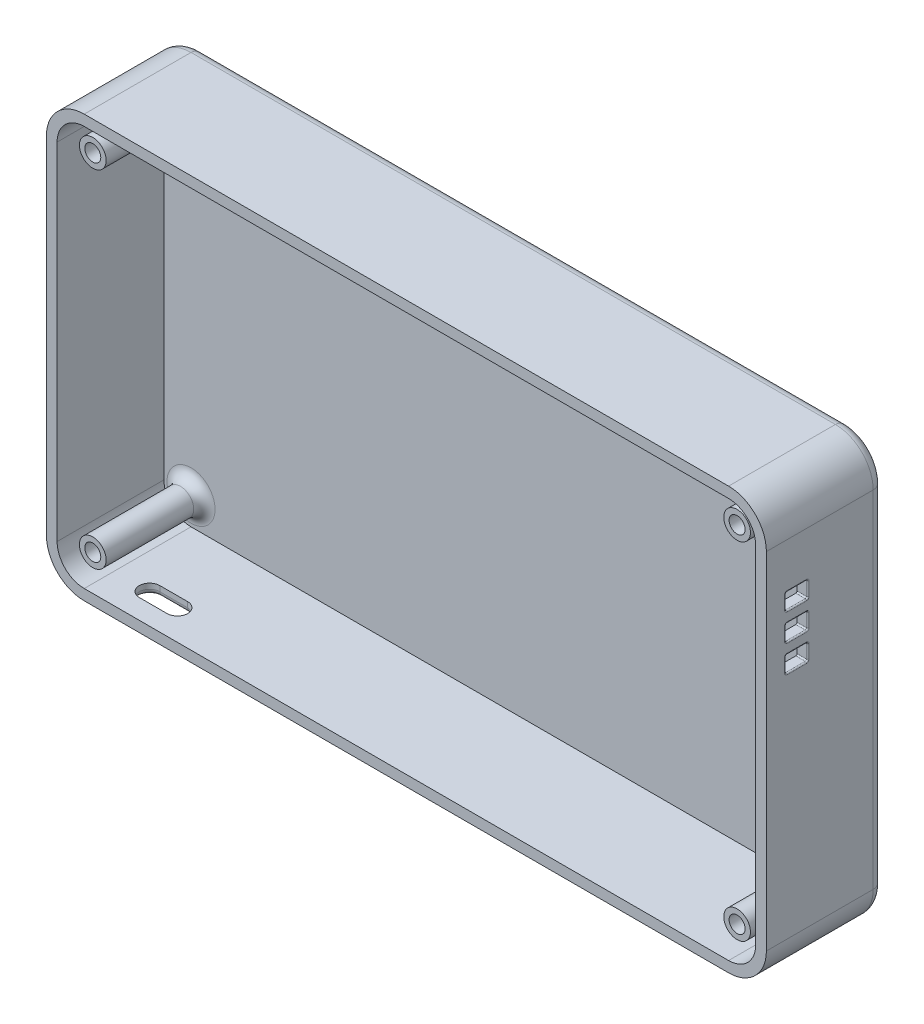
from build123d import *

# Parameters (mm, degrees)
ESQUISSE1_R             = 2.498391832
ESQUISSE1_R_2           = 2.5
BOSS_EXTRU_1_DEPTH      = 20
COQUE1_T                = 2
CONG_1_R                = 2
ESQUISSE2_R             = 1.5
ENL_V_MAT_EXTRU_1_DEPTH = 15
CONG_2_R                = 2
ESQUISSE6_R             = 2.498391832
ESQUISSE6_R_2           = 2.5
ENL_V_MAT_EXTRU_2_DEPTH = 15
ENL_V_MAT_EXTRU_3_DEPTH = 10
CONG_3_R                = 1
ESQUISSE9_W             = 4.1
ESQUISSE9_H             = 3
ENL_V_MAT_EXTRU_4_DEPTH = 10
CONG_4_R                = 0.25
ESQUISSE10_R            = 2.4
ENL_V_MAT_EXTRU_5_DEPTH = 10
CONG_5_R                = 0.25


with BuildPart() as part:
    # Esquisse1 → Boss.-Extru.1 (new body)
    with BuildSketch(Plane.XY):
        with BuildLine():
            Line((33.02, -40.64), (153.67, -40.64))
            ThreePointArc((153.67, -40.64), (157.262102448, -42.127897552), (158.75, -45.72))
            Line((158.75, -45.72), (158.75, -110.49))
            ThreePointArc((158.75, -110.49), (157.262102448, -114.082102448), (153.67, -115.57))
            Line((153.67, -115.57), (33.02, -115.57))
            ThreePointArc((33.02, -115.57), (29.427897552, -114.082102448), (27.94, -110.49))
            Line((27.94, -110.49), (27.94, -45.72))
            ThreePointArc((27.94, -45.72), (29.427897552, -42.127897552), (33.02, -40.64))
        make_face()
        with Locations((153.67, -110.49)):
            Circle(ESQUISSE1_R, mode=Mode.SUBTRACT)
        with Locations((33.02, -110.49)):
            Circle(ESQUISSE1_R_2, mode=Mode.SUBTRACT)
        with Locations((153.67, -45.72)):
            Circle(ESQUISSE1_R_2, mode=Mode.SUBTRACT)
        with Locations((33.02, -45.72)):
            Circle(ESQUISSE1_R_2, mode=Mode.SUBTRACT)
    extrude(amount=BOSS_EXTRU_1_DEPTH)

    # Coque1
    coque1_openings = [part.faces().sort_by_distance(p)[0] for p in [
        (93.345157035, -78.105084303, 20),
    ]]
    offset(amount=COQUE1_T, openings=coque1_openings, kind=Kind.INTERSECTION)

    # Congé1
    # the kernel refuses this fillet: 2 mm, written as the material it takes off along each edge
    with BuildSketch(Plane(origin=(33.02, -117.57, -2), x_dir=(0, 0, 1), z_dir=(1, 0, 0)), Plane(origin=(153.67, -38.64, -2), x_dir=(0, 0, 1), z_dir=(-1, 0, 0))) as cong_1_piece_1:
        with BuildLine():
            CenterArc((CONG_1_R, -CONG_1_R), CONG_1_R, 90, 90)
            Line((0, -CONG_1_R), (0, 0))
            Line((0, 0), (CONG_1_R, 0))
        make_face()
    extrude(amount=120.65, mode=Mode.SUBTRACT)
    with BuildSketch(Plane(origin=(33.02, -110.49, -2), x_dir=(0, -1, 0), z_dir=(1, 0, 0))) as cong_1_piece_2:
        with BuildLine():
            CenterArc((7.08 - CONG_1_R, -CONG_1_R), CONG_1_R, 0, 90)
            Line((7.08 - CONG_1_R, 0), (7.08, 0))
            Line((7.08, 0), (7.08, -CONG_1_R))
        make_face()
    revolve(axis=Axis((33.02, -110.49, -2), (0, 0, -1)), revolution_arc=90, mode=Mode.SUBTRACT)
    with BuildSketch(Plane(origin=(25.94, -45.72, -2), x_dir=(0, 0, 1), z_dir=(0, -1, 0)), Plane(origin=(160.75, -110.49, -2), x_dir=(0, 0, 1), z_dir=(0, 1, 0))) as cong_1_piece_3:
        with BuildLine():
            CenterArc((CONG_1_R, -CONG_1_R), CONG_1_R, 90, 90)
            Line((0, -CONG_1_R), (0, 0))
            Line((0, 0), (CONG_1_R, 0))
        make_face()
    extrude(amount=64.77, mode=Mode.SUBTRACT)
    with BuildSketch(Plane(origin=(33.02, -45.72, -2), x_dir=(-1, 0, 0), z_dir=(0, -1, 0))) as cong_1_piece_4:
        with BuildLine():
            CenterArc((7.08 - CONG_1_R, -CONG_1_R), CONG_1_R, 0, 90)
            Line((7.08 - CONG_1_R, 0), (7.08, 0))
            Line((7.08, 0), (7.08, -CONG_1_R))
        make_face()
    revolve(axis=Axis((33.02, -45.72, -2), (0, 0, -1)), revolution_arc=90, mode=Mode.SUBTRACT)
    with BuildSketch(Plane(origin=(153.67, -45.72, -2), x_dir=(0, 1, 0), z_dir=(-1, 0, 0))) as cong_1_piece_5:
        with BuildLine():
            CenterArc((7.08 - CONG_1_R, -CONG_1_R), CONG_1_R, 0, 90)
            Line((7.08 - CONG_1_R, 0), (7.08, 0))
            Line((7.08, 0), (7.08, -CONG_1_R))
        make_face()
    revolve(axis=Axis((153.67, -45.72, -2), (0, 0, -1)), revolution_arc=90, mode=Mode.SUBTRACT)
    with BuildSketch(Plane(origin=(153.67, -110.49, -2), x_dir=(1, 0, 0), z_dir=(0, 1, 0))) as cong_1_piece_6:
        with BuildLine():
            CenterArc((7.08 - CONG_1_R, -CONG_1_R), CONG_1_R, 0, 90)
            Line((7.08 - CONG_1_R, 0), (7.08, 0))
            Line((7.08, 0), (7.08, -CONG_1_R))
        make_face()
    revolve(axis=Axis((153.67, -110.49, -2), (0, 0, -1)), revolution_arc=90, mode=Mode.SUBTRACT)

    # Esquisse2 → Enlèv. mat.-Extru.1 (cut)
    with BuildSketch(Plane.XY.offset(20)):
        with Locations((153.67, -110.49)):
            Circle(ESQUISSE2_R)
        with Locations((33.02, -110.49)):
            Circle(ESQUISSE2_R)
        with Locations((33.02, -45.72)):
            Circle(ESQUISSE2_R)
        with Locations((153.67, -45.72)):
            Circle(ESQUISSE2_R)
    extrude(amount=-ENL_V_MAT_EXTRU_1_DEPTH, mode=Mode.SUBTRACT)

    # Congé2
    cong_2_edges = [part.edges().sort_by_distance(p)[0] for p in [
        (151.17, -45.72, 0),
        (151.171608168, -110.49, 0),
        (30.52, -110.49, 0),
        (30.52, -45.72, 0),
    ]]
    fillet(cong_2_edges, radius=CONG_2_R)

    # Esquisse6 → Enlèv. mat.-Extru.2 (cut)
    with BuildSketch(Plane.XY.offset(18.4)):
        with Locations(Location((153.67, -110.49, 0), (0, 0, 180))):
            Circle(ESQUISSE6_R)
        with Locations(Location((33.02, -110.49, 0), (0, 0, 180))):
            Circle(ESQUISSE6_R_2)
        with Locations(Location((33.02, -45.72, 0), (0, 0, 180))):
            Circle(ESQUISSE6_R_2)
        with Locations(Location((153.67, -45.72, 0), (0, 0, 180))):
            Circle(ESQUISSE6_R_2)
    extrude(amount=ENL_V_MAT_EXTRU_2_DEPTH, mode=Mode.SUBTRACT)

    # Esquisse7 → Enlèv. mat.-Extru.3 (cut)
    with BuildSketch(Plane.XZ.offset(117.57)):
        with BuildLine():
            Line((39.627249329, 16.302213906), (44.832750671, 16.302213906))
            ThreePointArc((44.832750671, 16.302213906), (46.763115827, 14.371848749), (44.832750671, 12.441483593))
            Line((44.832750671, 12.441483593), (39.627249329, 12.441483593))
            ThreePointArc((39.627249329, 12.441483593), (37.696884173, 14.371848749), (39.627249329, 16.302213906))
        make_face()
    extrude(amount=-ENL_V_MAT_EXTRU_3_DEPTH, mode=Mode.SUBTRACT)

    # Congé3
    cong_3_edges = [part.edges().sort_by_distance(p)[0] for p in [
        (37.696884173, -117.57, 14.371848749),
        (42.23, -117.57, 12.441483593),
        (46.763115827, -117.57, 14.371848749),
        (42.23, -117.57, 16.302213906),
    ]]
    fillet(cong_3_edges, radius=CONG_3_R)

    # Esquisse9 → Enlèv. mat.-Extru.4 (cut)
    with BuildSketch(Plane(origin=(160.75, 0, 0), x_dir=(0, 0, -1), z_dir=(1, 0, 0))):
        with Locations((-14.3, -65.88)):
            Rectangle(ESQUISSE9_W, ESQUISSE9_H)
        with Locations((-14.3, -60.8)):
            Rectangle(ESQUISSE9_W, ESQUISSE9_H)
        with Locations((-14.3, -55.72)):
            Rectangle(ESQUISSE9_W, ESQUISSE9_H)
    extrude(amount=-ENL_V_MAT_EXTRU_4_DEPTH, mode=Mode.SUBTRACT)

    # Congé4
    cong_4_edges = [part.edges().sort_by_distance(p)[0] for p in [
        (159.75, -67.38, 16.35),
        (159.75, -64.38, 16.35),
        (159.75, -64.38, 12.25),
        (159.75, -67.38, 12.25),
        (160.75, -65.88, 16.35),
        (160.75, -67.38, 14.3),
        (160.75, -65.88, 12.25),
        (160.75, -64.38, 14.3),
        (159.75, -62.3, 16.35),
        (159.75, -59.3, 16.35),
        (159.75, -59.3, 12.25),
        (159.75, -62.3, 12.25),
        (160.75, -60.8, 16.35),
        (160.75, -62.3, 14.3),
        (160.75, -60.8, 12.25),
        (160.75, -59.3, 14.3),
        (159.75, -57.22, 16.35),
        (159.75, -54.22, 16.35),
        (159.75, -54.22, 12.25),
        (159.75, -57.22, 12.25),
        (160.75, -55.72, 16.35),
        (160.75, -57.22, 14.3),
        (160.75, -55.72, 12.25),
        (160.75, -54.22, 14.3),
    ]]
    fillet(cong_4_edges, radius=CONG_4_R)

    # Esquisse10 → Enlèv. mat.-Extru.5 (cut)
    with BuildSketch(Plane(origin=(0, 0, -2), x_dir=(-1, 0, 0), z_dir=(0, 0, -1))):
        with Locations((-154.305, -65.88)):
            Circle(ESQUISSE10_R)
        with Locations((-154.305, -60.8)):
            Circle(ESQUISSE10_R)
        with Locations((-154.305, -55.72)):
            Circle(ESQUISSE10_R)
    extrude(amount=-ENL_V_MAT_EXTRU_5_DEPTH, mode=Mode.SUBTRACT)

    # Congé5
    # the kernel refuses this fillet: 0.25 mm, written as the material it takes off along each edge
    with BuildSketch(Plane(origin=(154.305, -65.88, -2), x_dir=(-1, 0, 0), z_dir=(0, -1, 0))) as cong_5_piece_1:
        with BuildLine():
            CenterArc((2.4 + CONG_5_R, -CONG_5_R), CONG_5_R, 90, 90)
            Line((2.4 + CONG_5_R, 0), (2.4, 0))
            Line((2.4, 0), (2.4, -CONG_5_R))
        make_face()
    revolve(axis=Axis((154.305, -65.88, -2), (0, 0, -1)), mode=Mode.SUBTRACT)
    with BuildSketch(Plane(origin=(154.305, -60.8, -2), x_dir=(-1, 0, 0), z_dir=(0, -1, 0))) as cong_5_piece_2:
        with BuildLine():
            CenterArc((2.4 + CONG_5_R, -CONG_5_R), CONG_5_R, 90, 90)
            Line((2.4 + CONG_5_R, 0), (2.4, 0))
            Line((2.4, 0), (2.4, -CONG_5_R))
        make_face()
    revolve(axis=Axis((154.305, -60.8, -2), (0, 0, -1)), mode=Mode.SUBTRACT)
    with BuildSketch(Plane(origin=(154.305, -55.72, -2), x_dir=(-1, 0, 0), z_dir=(0, -1, 0))) as cong_5_piece_3:
        with BuildLine():
            CenterArc((2.4 + CONG_5_R, -CONG_5_R), CONG_5_R, 90, 90)
            Line((2.4 + CONG_5_R, 0), (2.4, 0))
            Line((2.4, 0), (2.4, -CONG_5_R))
        make_face()
    revolve(axis=Axis((154.305, -55.72, -2), (0, 0, -1)), mode=Mode.SUBTRACT)


solid = part.part
